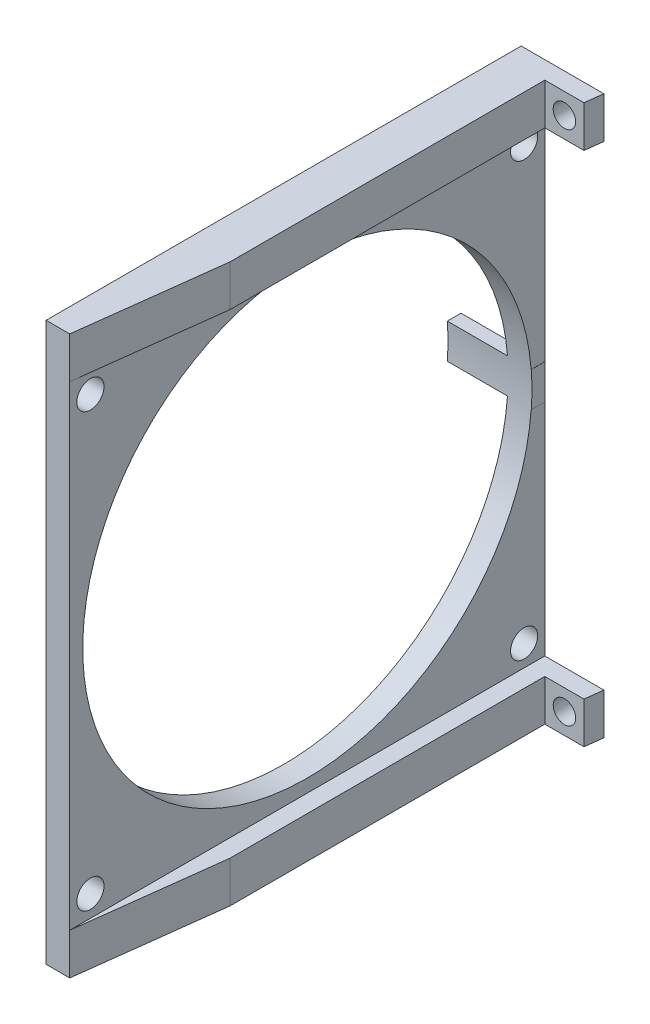
from build123d import *

# Parameters (mm, degrees)
SKETCH2_W               = 4
SKETCH2_H               = 80.4
BOSS_EXTRUDE1_DEPTH     = 80.4
SKETCH11_W              = 14.212865054
SKETCH11_H              = 5.892993274
BOSS_EXTRUDE4_DEPTH     = 4
CUT_EXTRUDE3_DEPTH      = 4
CUT_EXTRUDE3_DEPTH_BACK = 24
SKETCH3_R               = 2.3
SKETCH3_R_2             = 38
SKETCH4_W               = 80.4
SKETCH4_H               = 7
BOSS_EXTRUDE3_DEPTH     = 14
CUT_EXTRUDE5_DEPTH      = 95
SKETCH9_R               = 1.9
CUT_EXTRUDE6_DEPTH      = 95
CUT_EXTRUDE7_DEPTH      = 95


with BuildPart() as part:
    # Sketch2 → Boss-Extrude1 (new body)
    with BuildSketch(Plane(origin=(0, 0, 0), x_dir=(1, 0, 0), z_dir=(0, 1, 0))):
        with Locations((2, 40.2)):
            Rectangle(SKETCH2_W, SKETCH2_H)
    extrude(amount=BOSS_EXTRUDE1_DEPTH)

    # Sketch11 → Boss-Extrude4 (add)
    with BuildSketch(Plane(origin=(0, 0, -80.4), x_dir=(-1, 0, 0), z_dir=(0, 0, -1))):
        with Locations((3.081827719, 40.2)):
            Rectangle(SKETCH11_W, SKETCH11_H)
    extrude(amount=-BOSS_EXTRUDE4_DEPTH)

    # Sketch3 → Cut-Extrude3 (cut, two sides: drawn at the far end of the back side and taken through both)
    with BuildSketch(Plane(origin=(4, 0, 0), x_dir=(0, 0, -1), z_dir=(1, 0, 0)).offset(-CUT_EXTRUDE3_DEPTH_BACK)):
        with Locations((3.5, 76.8)):
            Circle(SKETCH3_R)
        with Locations((3.5, 3.6)):
            Circle(SKETCH3_R)
        with Locations((76.9, 3.6)):
            Circle(SKETCH3_R)
        with Locations((76.9, 76.8)):
            Circle(SKETCH3_R)
        with Locations((40.2, 40.2)):
            Circle(SKETCH3_R_2)
    extrude(amount=CUT_EXTRUDE3_DEPTH + CUT_EXTRUDE3_DEPTH_BACK, mode=Mode.SUBTRACT)

    # Sketch4 → Boss-Extrude3 (add)
    with BuildSketch(Plane.ZY):
        with Locations((-40.2, -3.5)):
            Rectangle(SKETCH4_W, SKETCH4_H)
        with Locations((-40.2, 83.9)):
            Rectangle(SKETCH4_W, SKETCH4_H)
    extrude(amount=-BOSS_EXTRUDE3_DEPTH)

    # Sketch8 → Cut-Extrude5 (cut)
    with BuildSketch(Plane(origin=(0, 87.4, 0), x_dir=(1, 0, 0), z_dir=(0, 1, 0))):
        Polygon((4, 0), (14, 0), (14, 80.4), align=None)
    extrude(amount=-CUT_EXTRUDE5_DEPTH, mode=Mode.SUBTRACT)

    # Sketch9 → Cut-Extrude6 (cut)
    with BuildSketch(Plane(origin=(0, 0, -80.4), x_dir=(-1, 0, 0), z_dir=(0, 0, -1))):
        with Locations((-10.320931221, 83.9)):
            Circle(SKETCH9_R)
        with Locations((-10.320931221, -3.5)):
            Circle(SKETCH9_R)
    extrude(amount=-CUT_EXTRUDE6_DEPTH, mode=Mode.SUBTRACT)

    # Sketch10 → Cut-Extrude7 (cut)
    with BuildSketch(Plane(origin=(0, 87.4, 0), x_dir=(1, 0, 0), z_dir=(0, 1, 0))):
        Polygon((7, 77.4), (13.626865672, 77.4), (7, 24.12), align=None)
    extrude(amount=-CUT_EXTRUDE7_DEPTH, mode=Mode.SUBTRACT)


solid = part.part
